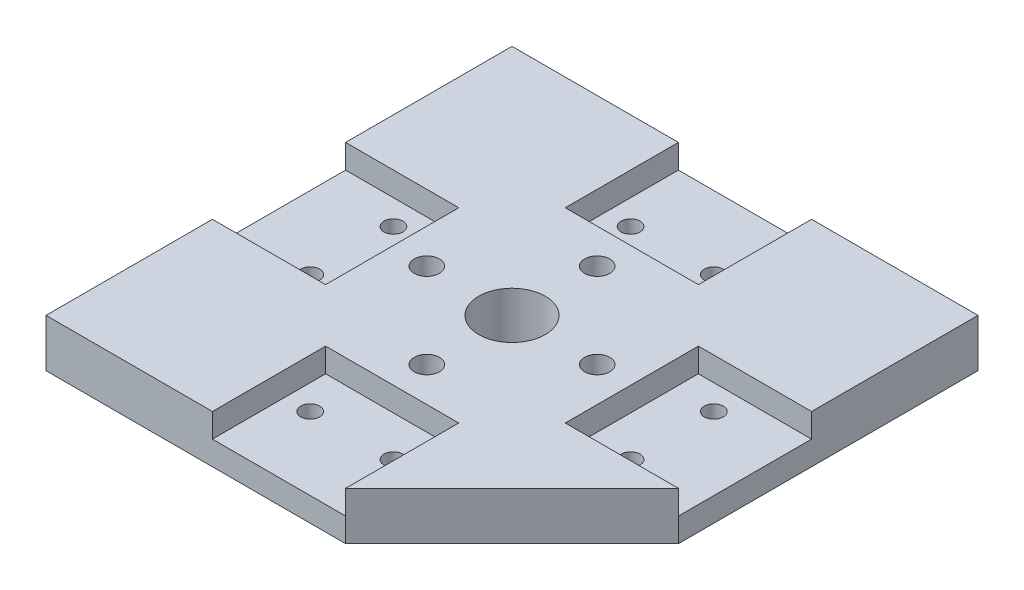
from build123d import *

# Parameters (mm, degrees)
SKETCH1_W           = 88.9
SKETCH1_H           = 88.9
BOSS_EXTRUDE1_DEPTH = 9.144
SKETCH2_W           = 25.4
SKETCH2_H           = 21.59
SKETCH2_W_2         = 21.59
SKETCH2_H_2         = 25.4
CUT_EXTRUDE1_DEPTH  = 4.572
SKETCH3_R           = 2.400000026
CUT_EXTRUDE2_DEPTH  = 127.055673161
SKETCH4_R           = 1.8034
CUT_EXTRUDE3_DEPTH  = 126.806689743
SKETCH5_R           = 6.35
CUT_EXTRUDE4_DEPTH  = 127.055673161
CUT_EXTRUDE5_DEPTH  = 127.055673161


with BuildPart() as part:
    # Sketch1 → Boss-Extrude1 (new body)
    with BuildSketch(Plane(origin=(0, 0, 0), x_dir=(1, 0, 0), z_dir=(0, 1, 0))):
        with Locations((44.45, 44.45)):
            Rectangle(SKETCH1_W, SKETCH1_H)
    extrude(amount=BOSS_EXTRUDE1_DEPTH)

    # Sketch2 → Cut-Extrude1 (cut)
    with BuildSketch(Plane(origin=(0, 9.144, 0), x_dir=(1, 0, 0), z_dir=(0, 1, 0))):
        with Locations((44.45, 78.105)):
            Rectangle(SKETCH2_W, SKETCH2_H)
        with Locations((10.795, 44.45)):
            Rectangle(SKETCH2_W_2, SKETCH2_H_2)
        with Locations((44.45, 10.795)):
            Rectangle(SKETCH2_W, SKETCH2_H)
        with Locations((78.105, 44.45)):
            Rectangle(SKETCH2_W_2, SKETCH2_H_2)
    extrude(amount=-CUT_EXTRUDE1_DEPTH, mode=Mode.SUBTRACT)

    # Sketch3 → Cut-Extrude2 (cut, through all)
    with BuildSketch(Plane(origin=(0, 9.144, 0), x_dir=(1, 0, 0), z_dir=(0, 1, 0))):
        with Locations((28.194, 44.45)):
            Circle(SKETCH3_R)
        with Locations((44.45, 60.706)):
            Circle(SKETCH3_R)
        with Locations((60.706, 44.45)):
            Circle(SKETCH3_R)
        with Locations((44.45, 28.194)):
            Circle(SKETCH3_R)
    extrude(amount=-CUT_EXTRUDE2_DEPTH, mode=Mode.SUBTRACT)

    # Sketch4 → Cut-Extrude3 (cut, through all)
    with BuildSketch(Plane(origin=(0, 4.572, 0), x_dir=(1, 0, 0), z_dir=(0, 1, 0))):
        with Locations((75.0062, 52.3875)):
            Circle(SKETCH4_R)
        with Locations((75.0062, 36.5125)):
            Circle(SKETCH4_R)
        with Locations((52.3875, 75.0062)):
            Circle(SKETCH4_R)
        with Locations((36.5125, 75.0062)):
            Circle(SKETCH4_R)
        with Locations((13.8938, 52.3875)):
            Circle(SKETCH4_R)
        with Locations((13.8938, 36.5125)):
            Circle(SKETCH4_R)
        with Locations((36.5125, 13.8938)):
            Circle(SKETCH4_R)
        with Locations((52.3875, 13.8938)):
            Circle(SKETCH4_R)
    extrude(amount=-CUT_EXTRUDE3_DEPTH, mode=Mode.SUBTRACT)

    # Sketch5 → Cut-Extrude4 (cut, through all)
    with BuildSketch(Plane(origin=(0, 9.144, 0), x_dir=(1, 0, 0), z_dir=(0, 1, 0))):
        with Locations((44.45, 44.45)):
            Circle(SKETCH5_R)
    extrude(amount=-CUT_EXTRUDE4_DEPTH, mode=Mode.SUBTRACT)

    # Sketch6 → Cut-Extrude5 (cut, through all)
    with BuildSketch(Plane(origin=(0, 9.144, 0), x_dir=(1, 0, 0), z_dir=(0, 1, 0))):
        Polygon((88.9, 31.75), (57.15, 0), (88.9, 0), align=None)
    extrude(amount=-CUT_EXTRUDE5_DEPTH, mode=Mode.SUBTRACT)


solid = part.part
